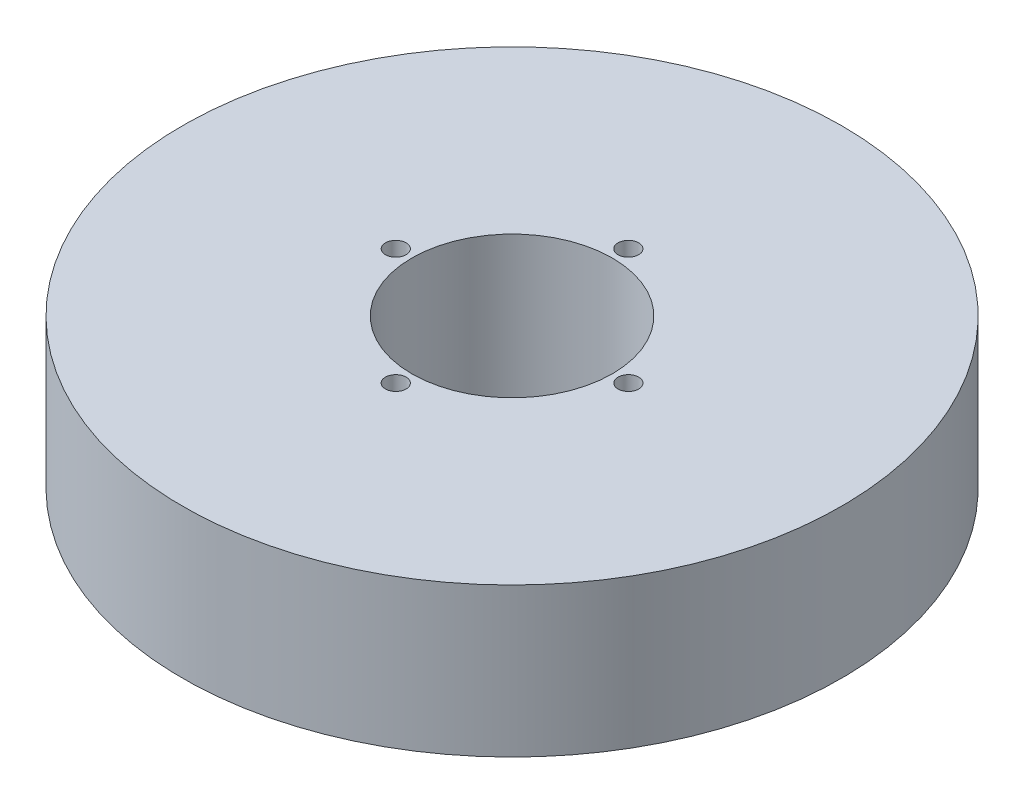
from build123d import *

# Parameters (mm, degrees)
SKETCH1_R           = 57.5
BOSS_EXTRUDE1_DEPTH = 26
SKETCH2_R           = 17.5
CUT_EXTRUDE1_DEPTH  = 86.372712268
SKETCH3_R           = 1.803600726
CUT_EXTRUDE2_DEPTH  = 18.478364313
CIRPATTERN1_COUNT   = 4


with BuildPart() as part:
    # Sketch1 → Boss-Extrude1 (new body)
    with BuildSketch(Plane(origin=(0, 0, 0), x_dir=(1, 0, 0), z_dir=(0, 1, 0))):
        Circle(SKETCH1_R)
    extrude(amount=BOSS_EXTRUDE1_DEPTH)

    # Sketch2 → Cut-Extrude1 (cut, through all)
    with BuildSketch(Plane(origin=(0, 0, 0), x_dir=(1, 0, 0), z_dir=(0, 1, 0))):
        Circle(SKETCH2_R)
    extrude(amount=CUT_EXTRUDE1_DEPTH, mode=Mode.SUBTRACT)

    # Sketch3 → Cut-Extrude2 (cut)
    with BuildSketch(Plane(origin=(0, 26, 0), x_dir=(1, 0, 0), z_dir=(0, 1, 0))):
        with Locations((-20.289524759, 0)):
            Circle(SKETCH3_R)
    cut_extrude2 = extrude(amount=-CUT_EXTRUDE2_DEPTH, mode=Mode.SUBTRACT)

    # CirPattern1: Cut-Extrude2 ×4 about axis
    cirpattern1_axis = Axis((0, 0, 0), (0, 1, 0))
    for i in range(1, CIRPATTERN1_COUNT):
        add(cut_extrude2.rotate(cirpattern1_axis, i * 360 / CIRPATTERN1_COUNT), mode=Mode.SUBTRACT)


solid = part.part
